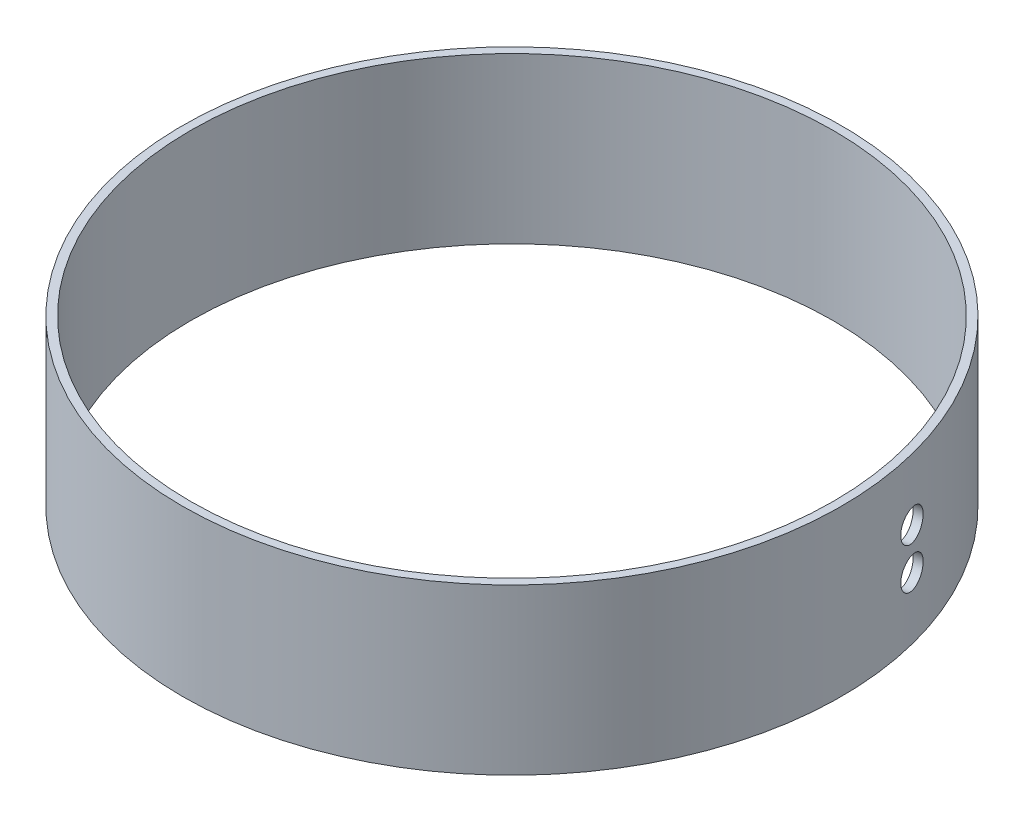
from build123d import *

# Parameters (mm, degrees)
SKETCH1_R           = 50.8
SKETCH1_R_2         = 49.53
BOSS_EXTRUDE1_DEPTH = 25.4
SKETCH2_R           = 2.38125
CUT_EXTRUDE1_DEPTH  = 25.4


with BuildPart() as part:
    # Sketch1 → Boss-Extrude1 (new body)
    with BuildSketch(Plane(origin=(0, 0, 0), x_dir=(1, 0, 0), z_dir=(0, 1, 0))):
        Circle(SKETCH1_R)
        Circle(SKETCH1_R_2, mode=Mode.SUBTRACT)
    extrude(amount=BOSS_EXTRUDE1_DEPTH)

    # Sketch2 → Cut-Extrude1 (cut)
    with BuildSketch(Plane(origin=(80.709285485, 206.333156205, 111.645979585), x_dir=(0, -1, 0), z_dir=(0.9693386284605577, 0, -0.2457287597620699))):
        with Locations((196.808156205, 128.055353348)):
            Circle(SKETCH2_R)
        with Locations((190.458156205, 128.055353348)):
            Circle(SKETCH2_R)
    extrude(amount=-CUT_EXTRUDE1_DEPTH, mode=Mode.SUBTRACT)


solid = part.part
